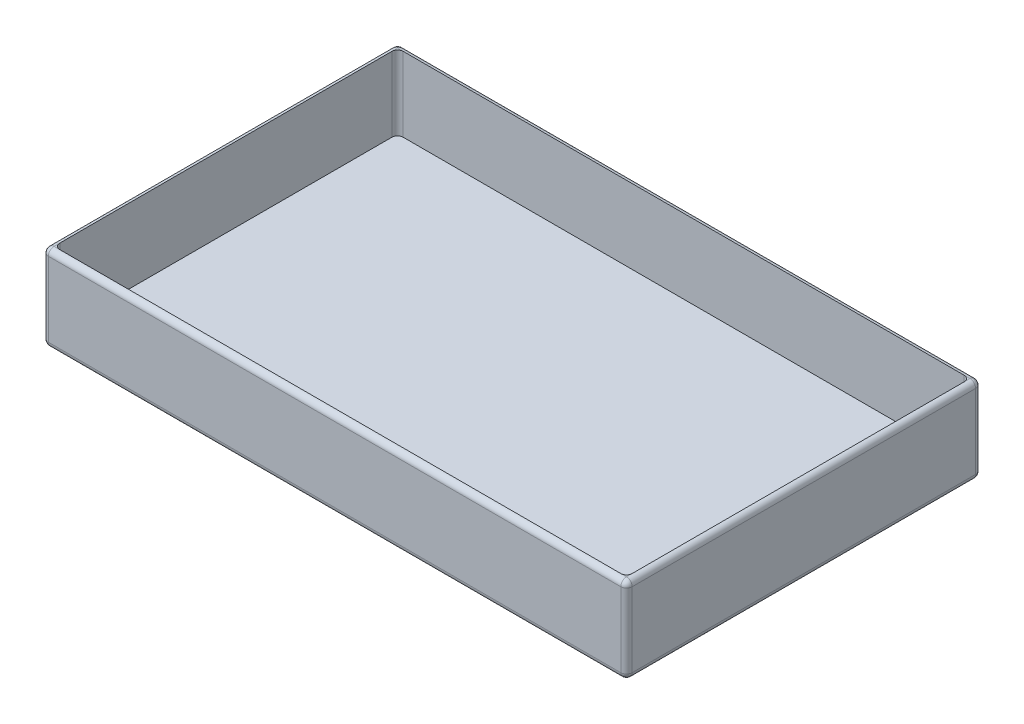
from build123d import *

# Parameters (mm, degrees)
SKETCH1_W           = 102
SKETCH1_H           = 62
BOSS_EXTRUDE1_DEPTH = 15
SKETCH2_W           = 100
SKETCH2_H           = 60
CUT_EXTRUDE1_DEPTH  = 13
FILLET2_R           = 1
FILLET3_R           = 1


with BuildPart() as part:
    # Sketch1 → Boss-Extrude1 (new body)
    with BuildSketch(Plane(origin=(0, 0, 0), x_dir=(1, 0, 0), z_dir=(0, 1, 0))):
        Rectangle(SKETCH1_W, SKETCH1_H)
    extrude(amount=BOSS_EXTRUDE1_DEPTH)

    # Sketch2 → Cut-Extrude1 (cut)
    with BuildSketch(Plane(origin=(0, 15, 0), x_dir=(1, 0, 0), z_dir=(0, 1, 0))):
        Rectangle(SKETCH2_W, SKETCH2_H)
    extrude(amount=-CUT_EXTRUDE1_DEPTH, mode=Mode.SUBTRACT)

    # Fillet2
    fillet2_edges = [part.edges().sort_by_distance(p)[0] for p in [
        (50, 8.5, -30),
        (50, 8.5, 30),
        (-50, 8.5, 30),
        (-50, 8.5, -30),
    ]]
    fillet(fillet2_edges, radius=FILLET2_R)

    # Fillet3
    fillet3_edges = [part.edges().sort_by_distance(p)[0] for p in [
        (-51, 15, 0),
        (0, 15, 31),
        (51, 15, 0),
        (0, 0, 31),
        (-51, 0, 0),
        (0, 0, -31),
        (51, 0, 0),
        (51, 7.5, 31),
        (-51, 7.5, 31),
        (-51, 7.5, -31),
        (51, 7.5, -31),
        (0, 15, -31),
    ]]
    fillet(fillet3_edges, radius=FILLET3_R - 0.0001)  # a hair under: the kernel refuses the full size


solid = part.part
